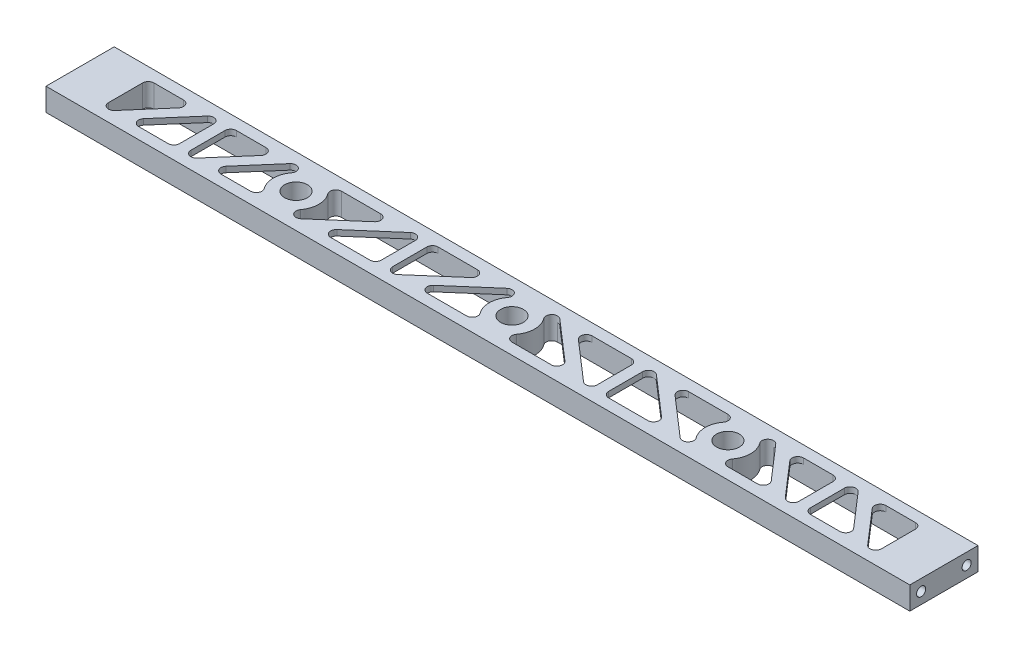
from build123d import *

# Parameters (mm, degrees)
SKETCH1_W                        = 38.1
SKETCH1_H                        = 12.7
BOSS_EXTRUDE1_DEPTH              = 241.3
F_1_4_20_TAPPED_HOLE1_AT_2_COUNT = 2
F_1_4_20_TAPPED_HOLE1_AT_2_PITCH = 25.4
SKETCH2_R                        = 6.35
CUT_EXTRUDE1_DEPTH               = 243.383750487
CUT_EXTRUDE2_DEPTH               = 9.525
CUT_EXTRUDE3_DEPTH               = 243.238143415


with BuildPart() as part:
    # Sketch1 → Boss-Extrude1 (new, symmetric)
    with BuildSketch(Plane(origin=(0, 0, 0), x_dir=(0, 0, -1), z_dir=(1, 0, 0))):
        Rectangle(SKETCH1_W, SKETCH1_H)
    extrude(amount=BOSS_EXTRUDE1_DEPTH, both=True)

    # Sketch3 → 1/4-20 Tapped Hole1 (revolve, cut)
    with BuildSketch(Plane(origin=(241.3, 0, 12.7), x_dir=(0, 0, -1), z_dir=(0, 1, 0))):
        Polygon((0, 0), (0, 20.583816902), (2.5527, 19.05), (2.5527, 0), align=None)
    f_1_4_20_tapped_hole1 = revolve(axis=Axis((247.65, 0, 12.7), (-1, 0, 0)), mode=Mode.SUBTRACT)

    # 1/4-20 Tapped Hole1 at 2: 1/4-20 Tapped Hole1 ×2
    with Locations(*[(0, 0, -i * F_1_4_20_TAPPED_HOLE1_AT_2_PITCH) for i in range(1, F_1_4_20_TAPPED_HOLE1_AT_2_COUNT)]):
        add(f_1_4_20_tapped_hole1, mode=Mode.SUBTRACT)

    # Sketch2 → Cut-Extrude1 (cut, through all)
    with BuildSketch(Plane(origin=(0, 6.35, 0), x_dir=(1, 0, 0), z_dir=(0, 1, 0))):
        Circle(SKETCH2_R)
        with Locations((120.65, 0)):
            Circle(SKETCH2_R)
    cut_extrude1 = extrude(amount=-CUT_EXTRUDE1_DEPTH, mode=Mode.SUBTRACT)

    # Sketch4 → Cut-Extrude2 (cut)
    with BuildSketch(Plane.XZ.offset(6.35)):
        with BuildLine():
            Line((12.7, 12.7), (107.95, 12.7))
            ThreePointArc((107.95, 12.7), (110.789806331, 10.944903166), (110.49, 7.62))
            ThreePointArc((110.49, 7.62), (107.95, 0), (110.49, -7.62))
            ThreePointArc((110.49, -7.62), (110.789806331, -10.944903166), (107.95, -12.7))
            Line((107.95, -12.7), (12.7, -12.7))
            ThreePointArc((12.7, -12.7), (9.860193669, -10.944903166), (10.16, -7.62))
            ThreePointArc((10.16, -7.62), (12.7, 0), (10.16, 7.62))
            ThreePointArc((10.16, 7.62), (9.860193669, 10.944903166), (12.7, 12.7))
        make_face()
        with BuildLine():
            Line((133.35, 12.7), (212.725, 12.7))
            ThreePointArc((212.725, 12.7), (214.97006403, 11.77006403), (215.9, 9.525))
            Line((215.9, 9.525), (215.9, -9.525))
            ThreePointArc((215.9, -9.525), (214.97006403, -11.77006403), (212.725, -12.7))
            Line((212.725, -12.7), (133.35, -12.7))
            ThreePointArc((133.35, -12.7), (130.510193669, -10.944903166), (130.81, -7.62))
            ThreePointArc((130.81, -7.62), (133.35, 0), (130.81, 7.62))
            ThreePointArc((130.81, 7.62), (130.510193669, 10.944903166), (133.35, 12.7))
        make_face()
    cut_extrude2 = extrude(amount=-CUT_EXTRUDE2_DEPTH, mode=Mode.SUBTRACT)

    # Mirror2: 1/4-20 Tapped Hole1, Cut-Extrude1, Cut-Extrude2 across plane
    add(f_1_4_20_tapped_hole1.mirror(Plane(origin=(0, 0, 0), x_dir=(0, 0, 1), z_dir=(1, 0, 0))), mode=Mode.SUBTRACT)
    add(cut_extrude1.mirror(Plane(origin=(0, 0, 0), x_dir=(0, 0, 1), z_dir=(1, 0, 0))), mode=Mode.SUBTRACT)
    add(cut_extrude2.mirror(Plane(origin=(0, 0, 0), x_dir=(0, 0, 1), z_dir=(1, 0, 0))), mode=Mode.SUBTRACT)

    # Mirror2 copy 1 sketch → Mirror2 copy 1 (revolve, cut)
    with BuildSketch(Plane(origin=(-241.3, 0, -12.7), x_dir=(0, 0, -1), z_dir=(0, 1, 0))):
        Polygon((0, 0), (0, -20.583816902), (2.5527, -19.05), (2.5527, 0), align=None)
    revolve(axis=Axis((-247.65, 0, -12.7), (-1, 0, 0)), mode=Mode.SUBTRACT)

    # Sketch5 → Cut-Extrude3 (cut, through all)
    with BuildSketch(Plane.XZ.offset(-3.175)):
        with BuildLine():
            Line((-107.95, -12.7), (-86.033840193, -12.7))
            ThreePointArc((-86.033840193, -12.7), (-83.059885373, -10.636853284), (-83.950941652, -7.128719827))
            Line((-83.950941652, -7.128719827), (-105.867101459, 11.921280173))
            ThreePointArc((-105.867101459, 11.921280173), (-110.112750151, 11.849464838), (-110.49, 7.62))
            ThreePointArc((-110.49, 7.62), (-107.95, 0), (-110.49, -7.62))
            ThreePointArc((-110.49, -7.62), (-110.789806331, -10.944903166), (-107.95, -12.7))
        make_face()
        with BuildLine():
            Line((-88.591159807, 12.7), (-66.675, 12.7))
            ThreePointArc((-66.675, 12.7), (-64.42993597, 11.77006403), (-63.5, 9.525))
            Line((-63.5, 9.525), (-63.5, -9.525))
            ThreePointArc((-63.5, -9.525), (-65.358295376, -12.414102617), (-68.757898541, -11.921280173))
            Line((-68.757898541, -11.921280173), (-90.674058348, 7.128719827))
            ThreePointArc((-90.674058348, 7.128719827), (-91.565114627, 10.636853284), (-88.591159807, 12.7))
        make_face()
        with BuildLine():
            Line((-12.7, 12.7), (-34.616159807, 12.7))
            ThreePointArc((-34.616159807, 12.7), (-37.590114627, 10.636853284), (-36.699058348, 7.128719827))
            Line((-36.699058348, 7.128719827), (-14.782898541, -11.921280173))
            ThreePointArc((-14.782898541, -11.921280173), (-10.537249849, -11.849464838), (-10.16, -7.62))
            ThreePointArc((-10.16, -7.62), (-12.7, 0), (-10.16, 7.62))
            ThreePointArc((-10.16, 7.62), (-9.860193669, 10.944903166), (-12.7, 12.7))
        make_face()
        with BuildLine():
            Line((-57.15, 9.525), (-57.15, -9.525))
            ThreePointArc((-57.15, -9.525), (-56.22006403, -11.77006403), (-53.975, -12.7))
            Line((-53.975, -12.7), (-32.058840193, -12.7))
            ThreePointArc((-32.058840193, -12.7), (-29.084885373, -10.636853284), (-29.975941652, -7.128719827))
            Line((-29.975941652, -7.128719827), (-51.892101459, 11.921280173))
            ThreePointArc((-51.892101459, 11.921280173), (-55.291704624, 12.414102617), (-57.15, 9.525))
        make_face()
        with BuildLine():
            Line((-133.35, 12.7), (-149.875066478, 12.7))
            ThreePointArc((-149.875066478, 12.7), (-152.763506605, 10.843157287), (-152.273440274, 7.444512524))
            Line((-152.273440274, 7.444512524), (-135.748373796, -11.605487476))
            ThreePointArc((-135.748373796, -11.605487476), (-131.35599847, -11.995745414), (-130.81, -7.62))
            ThreePointArc((-130.81, -7.62), (-133.35, 0), (-130.81, 7.62))
            ThreePointArc((-130.81, 7.62), (-130.510193669, 10.944903166), (-133.35, 12.7))
        make_face()
        with BuildLine():
            Line((-164.289126204, 11.605487476), (-147.764059726, -7.444512524))
            ThreePointArc((-147.764059726, -7.444512524), (-147.273993395, -10.843157287), (-150.162433522, -12.7))
            Line((-150.162433522, -12.7), (-166.6875, -12.7))
            ThreePointArc((-166.6875, -12.7), (-168.93256403, -11.77006403), (-169.8625, -9.525))
            Line((-169.8625, -9.525), (-169.8625, 9.525))
            ThreePointArc((-169.8625, 9.525), (-167.797857645, 12.499513557), (-164.289126204, 11.605487476))
        make_face()
        with BuildLine():
            Line((-176.2125, 9.525), (-176.2125, -9.525))
            ThreePointArc((-176.2125, -9.525), (-178.277142355, -12.499513557), (-181.785873796, -11.605487476))
            Line((-181.785873796, -11.605487476), (-198.310940274, 7.444512524))
            ThreePointArc((-198.310940274, 7.444512524), (-198.801006605, 10.843157287), (-195.912566478, 12.7))
            Line((-195.912566478, 12.7), (-179.3875, 12.7))
            ThreePointArc((-179.3875, 12.7), (-177.14243597, 11.77006403), (-176.2125, 9.525))
        make_face()
        with BuildLine():
            Line((-210.326626204, 11.605487476), (-193.801559726, -7.444512524))
            ThreePointArc((-193.801559726, -7.444512524), (-193.311493395, -10.843157287), (-196.199933522, -12.7))
            Line((-196.199933522, -12.7), (-212.725, -12.7))
            ThreePointArc((-212.725, -12.7), (-214.97006403, -11.77006403), (-215.9, -9.525))
            Line((-215.9, -9.525), (-215.9, 9.525))
            ThreePointArc((-215.9, 9.525), (-213.835357645, 12.499513557), (-210.326626204, 11.605487476))
        make_face()
    cut_extrude3 = extrude(amount=-CUT_EXTRUDE3_DEPTH, mode=Mode.SUBTRACT)

    # Mirror3: Cut-Extrude3 across plane
    add(cut_extrude3.mirror(Plane(origin=(0, 0, 0), x_dir=(0, 0, 1), z_dir=(1, 0, 0))), mode=Mode.SUBTRACT)


solid = part.part
